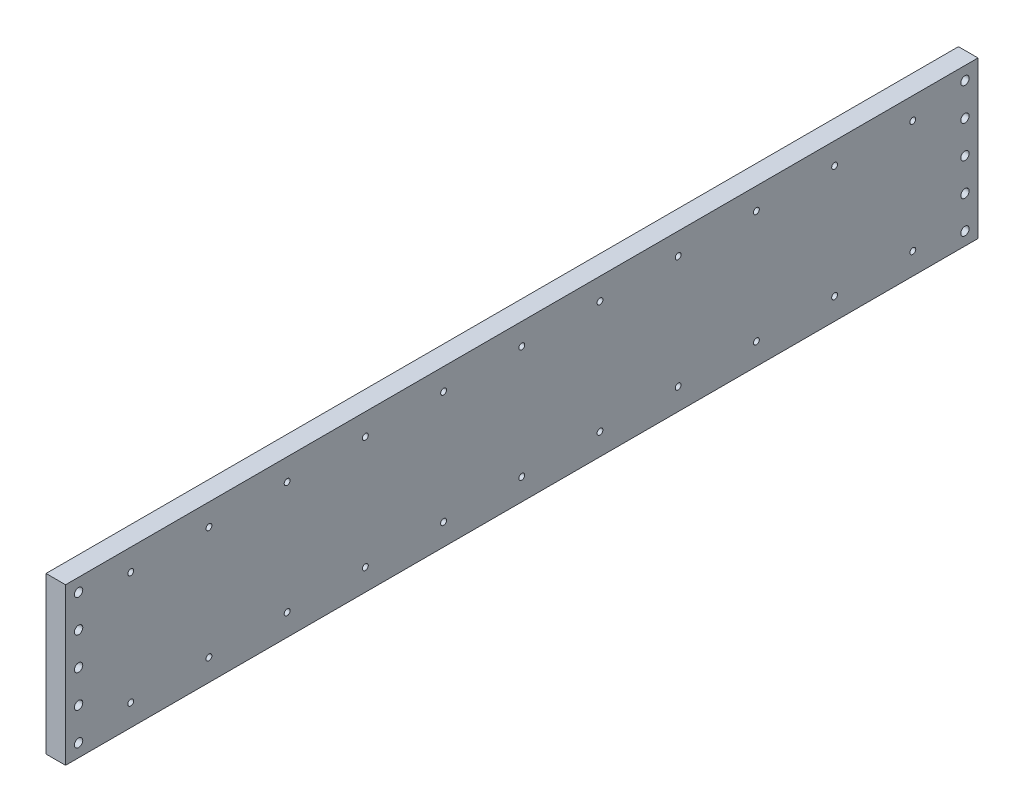
from build123d import *

# Parameters (mm, degrees)
SKETCH2_W                      = 15
SKETCH2_H                      = 120
BOSS_EXTRUDE1_DEPTH            = 700
F_4_5_4_5_DIAMETER_HOLE1_D     = 4.5
CBORE_FOR_M6_SHCS1_D           = 6.4
CBORE_FOR_M6_SHCS1_CBORE_D     = 11
CBORE_FOR_M6_SHCS1_CBORE_DEPTH = 6


with BuildPart() as part:
    # Sketch2 → Boss-Extrude1 (new body)
    with BuildSketch(Plane.XY):
        with Locations((-7.5, -60)):
            Rectangle(SKETCH2_W, SKETCH2_H)
    extrude(amount=BOSS_EXTRUDE1_DEPTH)

    # Ø4.5 (4.5) Diameter Hole1 (through all)
    with Locations(Plane(origin=(0, -16.7, 650), x_dir=(0, 0, 1), z_dir=(1, 0, 0))):
        with Locations((0, 0), (-60, 0), (-120, 0), (-180, 0), (-240, 0), (-300, 0), (-360, 0), (-420, 0), (-480, 0), (-540, 0), (-600, 0), (0, 86.6), (-60, 86.6), (-120, 86.6), (-180, 86.6), (-240, 86.6), (-300, 86.6), (-360, 86.6), (-420, 86.6), (-480, 86.6), (-540, 86.6), (-600, 86.6)):
            Hole(F_4_5_4_5_DIAMETER_HOLE1_D / 2)

    # CBORE for M6 SHCS1 (through all)
    with Locations(Plane(origin=(-15, -10, 690), x_dir=(0, 0, -1), z_dir=(-1, 0, 0))):
        with Locations((0, 0), (0, 50), (0, 25), (0, 75), (0, 100), (680, 0), (680, 25), (680, 50), (680, 75), (680, 100)):
            CounterBoreHole(CBORE_FOR_M6_SHCS1_D / 2, CBORE_FOR_M6_SHCS1_CBORE_D / 2, CBORE_FOR_M6_SHCS1_CBORE_DEPTH)


solid = part.part
